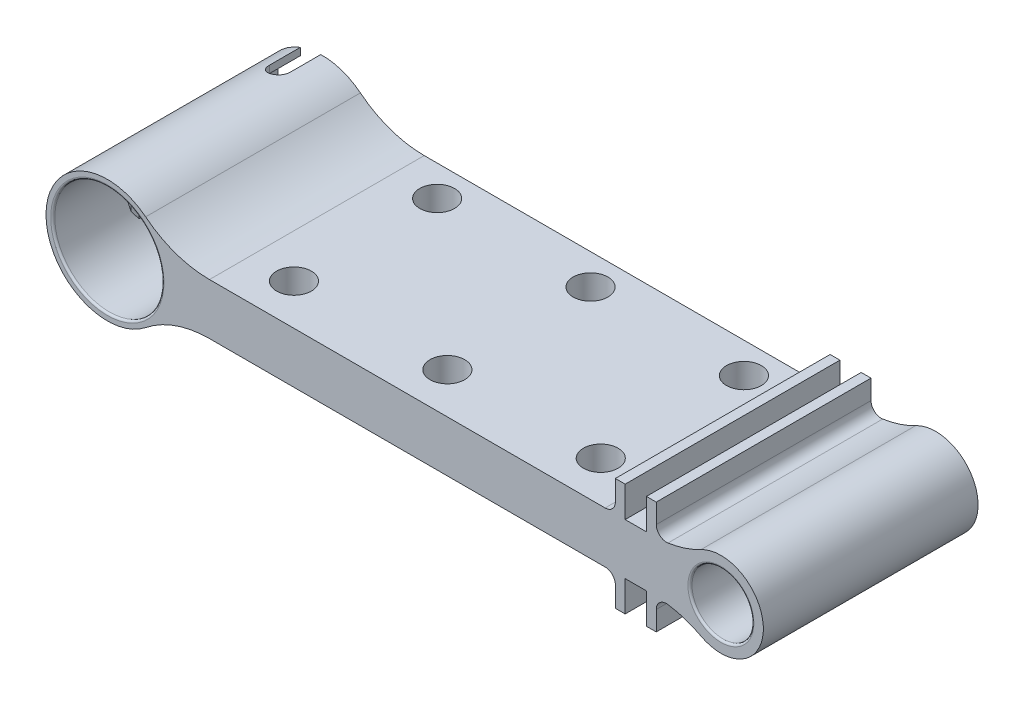
from build123d import *

# Parameters (mm, degrees)
BOSS_EXTRUDE1_DEPTH = 21
SKETCH2_R           = 5.34
CUT_EXTRUDE1_DEPTH  = 7
CUT_EXTRUDE2_DEPTH  = 39.078996836
CHAMFER1_SIZE       = 0.4
FILLET1_R           = 10
SKETCH4_R           = 1
CUT_EXTRUDE3_DEPTH  = 8.125
SKETCH6_R           = 4.15
BOSS_EXTRUDE2_DEPTH = 21
FILLET2_R           = 10
SKETCH5_R           = 1.5
CUT_EXTRUDE5_DEPTH  = 4.2
SKETCH7_R           = 3.025
CUT_EXTRUDE6_DEPTH  = 9
FILLET3_R           = 0.2
SKETCH8_W           = 0.96
SKETCH8_H           = 4
BOSS_EXTRUDE3_DEPTH = 21
FILLET4_R           = 1
SKETCH10_R          = 1.7
CUT_EXTRUDE7_DEPTH  = 43.006695945
SKETCH12_W          = 4
SKETCH12_H          = 1
CUT_EXTRUDE8_DEPTH  = 42.542899564


with BuildPart() as part:
    # Sketch1 → Boss-Extrude1 (new body)
    with BuildSketch(Plane.XY):
        with BuildLine():
            Line((-23.445643943, -2.5), (31.1, -2.5))
            ThreePointArc((31.1, -2.5), (33.6, 0), (31.1, 2.5))
            Line((31.1, 2.5), (-23.445643943, 2.5))
            ThreePointArc((-23.445643943, 2.5), (-34.9, 0), (-23.445643943, -2.5))
        make_face()
    extrude(amount=BOSS_EXTRUDE1_DEPTH)

    # Sketch2 → Cut-Extrude1 (cut)
    with BuildSketch(Plane.XY.offset(21)):
        with Locations((-28.9, 0)):
            Circle(SKETCH2_R)
    extrude(amount=-CUT_EXTRUDE1_DEPTH, mode=Mode.SUBTRACT)

    # Sketch3 → Cut-Extrude2 (cut, through all)
    with BuildSketch(Plane.XY.offset(14)):
        with BuildLine():
            Line((-33.19, 3.179858487), (-33.19, -3.179858487))
            ThreePointArc((-33.19, -3.179858487), (-28.9, -5.34), (-24.61, -3.179858487))
            Line((-24.61, -3.179858487), (-24.61, 3.179858487))
            ThreePointArc((-24.61, 3.179858487), (-28.9, 5.34), (-33.19, 3.179858487))
        make_face()
    extrude(amount=-CUT_EXTRUDE2_DEPTH, mode=Mode.SUBTRACT)

    # Chamfer1
    # the kernel refuses this chamfer: 0.4 mm, written as the material it takes off along each edge
    with BuildSketch(Plane(origin=(-24.61, -4.208531683, 14), x_dir=(-0.027495876610587302, 0, -0.9996219169112966), z_dir=(0, 1, 0))) as chamfer1_piece_1_section:
        Polygon((CHAMFER1_SIZE * 0.999621916911, -CHAMFER1_SIZE * 0.0274958766106), (-CHAMFER1_SIZE * 0.0274958766106, -CHAMFER1_SIZE * 0.999621916911), (0, 0), align=None)
    chamfer1_piece_1 = extrude(amount=8.417063365, mode=Mode.PRIVATE)
    chamfer1_piece_1 = chamfer1_piece_1 & Plane(origin=(-28.9, 0, 13.865333272), x_dir=(0.803370786516886, 0.595479117493838, 0), z_dir=(0, 0, 1)) * Cylinder(5.34, 19, mode=Mode.PRIVATE)
    add(chamfer1_piece_1, mode=Mode.SUBTRACT)
    with BuildSketch(Plane(origin=(-33.19, 4.208531683, 14), x_dir=(0.027495876610578673, 0, -0.999621916911297), z_dir=(0, -1, 0))) as chamfer1_piece_2_section:
        Polygon((CHAMFER1_SIZE * 0.999621916911, -CHAMFER1_SIZE * 0.0274958766106), (-CHAMFER1_SIZE * 0.0274958766106, -CHAMFER1_SIZE * 0.999621916911), (0, 0), align=None)
    chamfer1_piece_2 = extrude(amount=8.417063365, mode=Mode.PRIVATE)
    chamfer1_piece_2 = chamfer1_piece_2 & Plane(origin=(-28.9, 0, 13.865333272), x_dir=(0.803370786516886, 0.595479117493838, 0), z_dir=(0, 0, 1)) * Cylinder(5.34, 19, mode=Mode.PRIVATE)
    add(chamfer1_piece_2, mode=Mode.SUBTRACT)

    # Fillet1
    fillet1_edges = [part.edges().sort_by_distance(p)[0] for p in [
        (-23.445643943, 2.5, 10.5),
        (-23.445643943, -2.5, 10.5),
    ]]
    fillet(fillet1_edges, radius=FILLET1_R)

    # Sketch4 → Cut-Extrude3 (cut, symmetric)
    with BuildSketch(Plane(origin=(0, 0, 0), x_dir=(1, 0, 0), z_dir=(0, 1, 0))):
        with Locations((-30.027345217, -3)):
            Circle(SKETCH4_R)
        with BuildLine():
            ThreePointArc((-31.027345217, -3), (-30.027345217, -2), (-29.027345217, -3))
            Line((-29.027345217, -3), (-29.027345217, 4))
            Line((-29.027345217, 4), (-31.027345217, 4))
            Line((-31.027345217, 4), (-31.027345217, -3))
        make_face()
    extrude(amount=CUT_EXTRUDE3_DEPTH, both=True, mode=Mode.SUBTRACT)

    # Sketch6 → Boss-Extrude2 (add, through all)
    with BuildSketch(Plane.XY.offset(21)):
        with Locations((31.1, 0)):
            Circle(SKETCH6_R)
    extrude(amount=-BOSS_EXTRUDE2_DEPTH)

    # Fillet2
    fillet2_edges = [part.edges().sort_by_distance(p)[0] for p in [
        (27.787523585, 2.5, 10.5),
        (27.787523585, -2.5, 10.5),
    ]]
    fillet(fillet2_edges, radius=FILLET2_R)

    # Sketch5 → Cut-Extrude5 (cut)
    with BuildSketch(Plane(origin=(0, 0, 0), x_dir=(-1, 0, 0), z_dir=(0, 0, -1))):
        with Locations((-31.1, 0)):
            Circle(SKETCH5_R)
        with Locations((-6.1, 0)):
            Circle(SKETCH5_R)
        with Locations((18.9, 0)):
            Circle(SKETCH5_R)
    extrude(amount=-CUT_EXTRUDE5_DEPTH, mode=Mode.SUBTRACT)

    # Sketch7 → Cut-Extrude6 (cut)
    with BuildSketch(Plane.XY.offset(21)):
        with Locations((31.1, 0)):
            Circle(SKETCH7_R)
    extrude(amount=-CUT_EXTRUDE6_DEPTH, mode=Mode.SUBTRACT)

    # Fillet3
    fillet3_edges = [part.edges().sort_by_distance(p)[0] for p in [
        (28.075, 0, 21),
        (-34.24, 0, 21),
    ]]
    fillet(fillet3_edges, radius=FILLET3_R)

    # Sketch8 → Boss-Extrude3 (add, through all)
    with BuildSketch(Plane.XY.offset(21)):
        with Locations((21.258157906, 4.5)):
            Rectangle(SKETCH8_W, SKETCH8_H)
        with Locations((24.298157906, 4.5)):
            Rectangle(SKETCH8_W, SKETCH8_H)
        with Locations((21.258157906, -4.5)):
            Rectangle(SKETCH8_W, SKETCH8_H)
        with Locations((24.298157906, -4.5)):
            Rectangle(SKETCH8_W, SKETCH8_H)
    extrude(amount=-BOSS_EXTRUDE3_DEPTH)

    # Fillet4
    fillet4_edges = [part.edges().sort_by_distance(p)[0] for p in [
        (20.778157906, 2.5, 10.5),
        (24.778157906, 2.50478553, 10.5),
        (20.778157906, -2.5, 10.5),
        (24.778157906, -2.50478553, 10.5),
    ]]
    fillet(fillet4_edges, radius=FILLET4_R)

    # Sketch10 → Cut-Extrude7 (cut, through all)
    with BuildSketch(Plane(origin=(0, 2.5, 0), x_dir=(1, 0, 0), z_dir=(0, 1, 0))):
        with Locations(Location((-14.648773097, -17, 0), (0, 0, 180))):
            Circle(SKETCH10_R)
        with Locations(Location((0.351226903, -17, 0), (0, 0, 180))):
            Circle(SKETCH10_R)
        with Locations(Location((15.351226903, -17, 0), (0, 0, 180))):
            Circle(SKETCH10_R)
        with Locations(Location((0.351226903, -3, 0), (0, 0, 180))):
            Circle(SKETCH10_R)
        with Locations(Location((15.351226903, -3, 0), (0, 0, 180))):
            Circle(SKETCH10_R)
        with Locations(Location((-14.648773097, -3, 0), (0, 0, 180))):
            Circle(SKETCH10_R)
    extrude(amount=-CUT_EXTRUDE7_DEPTH, mode=Mode.SUBTRACT)

    # Sketch12 → Cut-Extrude8 (cut, through all)
    with BuildSketch(Plane.XY.offset(21)):
        with Locations((22.778157906, 6)):
            Rectangle(SKETCH12_W, SKETCH12_H)
        with Locations((22.778157906, -6)):
            Rectangle(SKETCH12_W, SKETCH12_H)
    extrude(amount=-CUT_EXTRUDE8_DEPTH, mode=Mode.SUBTRACT)


solid = part.part
